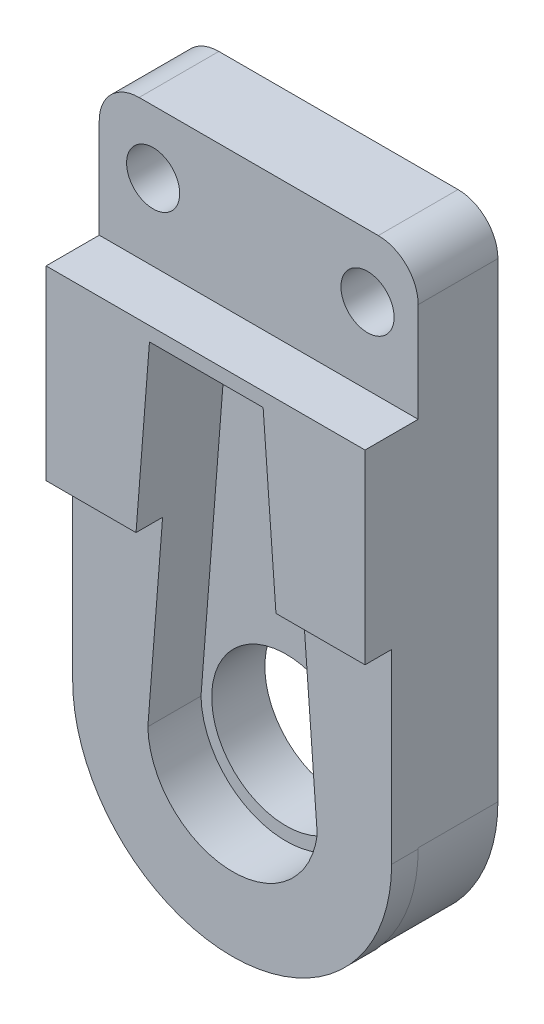
from build123d import *

# Parameters (mm, degrees)
SKETCH1_W           = 12
SKETCH1_H           = 25.2
BOSS_EXTRUDE1_DEPTH = 3
FILLET1_R           = 6
SKETCH3_W           = 12
SKETCH3_H           = 20
BOSS_EXTRUDE2_DEPTH = 2
FILLET2_R           = 6
CUT_EXTRUDE1_DEPTH  = 3
SKETCH5_R           = 2.8
CUT_EXTRUDE2_DEPTH  = 126.573231257
SKETCH6_R           = 1
CUT_EXTRUDE3_DEPTH  = 126.573231257
SKETCH7_W           = 12.403914783
SKETCH7_H           = 13.383655683
CUT_EXTRUDE4_DEPTH  = 1
FILLET3_R           = 1.5


with BuildPart() as part:
    # Sketch1 → Boss-Extrude1 (new body)
    with BuildSketch(Plane.XY.offset(5)):
        with Locations((-54.027704131, 97.655662644)):
            Rectangle(SKETCH1_W, SKETCH1_H)
    extrude(amount=BOSS_EXTRUDE1_DEPTH)

    # Fillet1
    fillet1_edges = [part.edges().sort_by_distance(p)[0] for p in [
        (-48.027704131, 85.055662644, 6.5),
        (-60.027704131, 85.055662644, 6.5),
    ]]
    fillet(fillet1_edges, radius=FILLET1_R - 0.0001)  # a hair under: the kernel refuses the full size

    # Sketch3 → Boss-Extrude2 (add)
    with BuildSketch(Plane.XY.offset(8)):
        with Locations((-54.027704131, 95.017998247)):
            Rectangle(SKETCH3_W, SKETCH3_H)
    extrude(amount=BOSS_EXTRUDE2_DEPTH)

    # Fillet2
    fillet2_edges = [part.edges().sort_by_distance(p)[0] for p in [
        (-48.027704131, 85.017998247, 9),
        (-60.027704131, 85.017998247, 9),
    ]]
    fillet(fillet2_edges, radius=FILLET2_R - 0.0001)  # a hair under: the kernel refuses the full size

    # Sketch4 → Cut-Extrude1 (cut, symmetric)
    with BuildSketch(Plane.XY.offset(10)):
        with BuildLine():
            Line((-56.13842392, 104.48600769), (-51.86157608, 104.48600769))
            Line((-51.86157608, 104.48600769), (-50.824897766, 90.586959839))
            ThreePointArc((-50.824897766, 90.586959839), (-54.164460237, 87.789583498), (-57.199226379, 90.914993286))
            Line((-57.199226379, 90.914993286), (-56.13842392, 104.48600769))
        make_face()
    extrude(amount=CUT_EXTRUDE1_DEPTH, both=True, mode=Mode.SUBTRACT)

    # Sketch5 → Cut-Extrude2 (cut, through all)
    with BuildSketch(Plane.XY.offset(7)):
        with Locations((-53.997448325, 91.08203191)):
            Circle(SKETCH5_R)
    extrude(amount=-CUT_EXTRUDE2_DEPTH, mode=Mode.SUBTRACT)

    # Sketch6 → Cut-Extrude3 (cut, through all)
    with BuildSketch(Plane.XY.offset(8)):
        with Locations((-57.999885247, 107.886757068)):
            Circle(SKETCH6_R)
        with Locations((-49.934118523, 107.886757068)):
            Circle(SKETCH6_R)
    extrude(amount=-CUT_EXTRUDE3_DEPTH, mode=Mode.SUBTRACT)

    # Sketch7 → Cut-Extrude4 (cut)
    with BuildSketch(Plane.XY.offset(10)):
        with Locations((-53.82574674, 91.326170406)):
            Rectangle(SKETCH7_W, SKETCH7_H)
    extrude(amount=-CUT_EXTRUDE4_DEPTH, mode=Mode.SUBTRACT)

    # Fillet3
    fillet3_edges = [part.edges().sort_by_distance(p)[0] for p in [
        (-60.027704131, 110.255662644, 6.5),
        (-48.027704131, 110.255662644, 6.5),
    ]]
    fillet(fillet3_edges, radius=FILLET3_R)


solid = part.part
